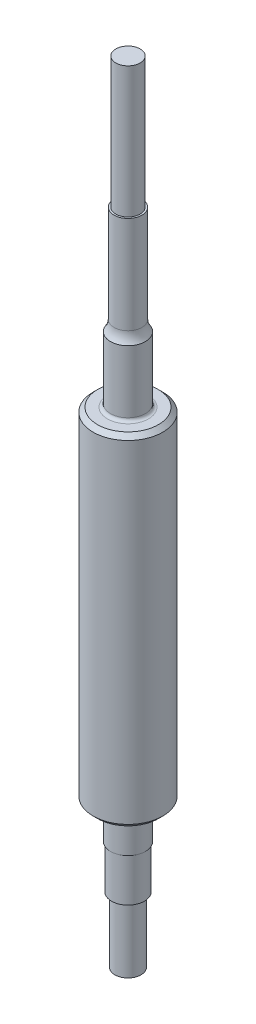
from build123d import *

# Parameters (mm, degrees)
SKETCH1_R           = 7.975
BOSS_EXTRUDE1_DEPTH = 78.2
SKETCH2_R           = 4
BOSS_EXTRUDE2_DEPTH = 15
BOSS_EXTRUDE3_START = 8
SKETCH3_R           = 4
BOSS_EXTRUDE3_DEPTH = 8
SKETCH4_R           = 3.195
BOSS_EXTRUDE4_DEPTH = 24.7
SKETCH5_R           = 2.79
BOSS_EXTRUDE5_DEPTH = 30
BOSS_EXTRUDE7_START = 8
SKETCH3_2_R         = 4
BOSS_EXTRUDE7_DEPTH = 8
SKETCH11_R          = 3.76
BOSS_EXTRUDE8_DEPTH = 10
SKETCH12_R          = 3
BOSS_EXTRUDE9_DEPTH = 15
CHAMFER6_SIZE       = 1
CHAMFER7_SIZE       = 1
FILLET1_R           = 0.7
FILLET3_R           = 0.7
FILLET4_R           = 4


with BuildPart() as part:
    # Sketch1 → Boss-Extrude1 (new body)
    with BuildSketch(Plane(origin=(0, 0, 0), x_dir=(1, 0, 0), z_dir=(0, 1, 0))):
        with Locations(Location((0, 0, 0), (0, 0, 270))):
            Circle(SKETCH1_R)
    extrude(amount=BOSS_EXTRUDE1_DEPTH)

    # Sketch2 → Boss-Extrude2 (add)
    with BuildSketch(Plane(origin=(0, 78.2, 0), x_dir=(1, 0, 0), z_dir=(0, 1, 0))):
        with Locations(Location((0, 0, 0), (0, 0, 270))):
            Circle(SKETCH2_R)
    extrude(amount=BOSS_EXTRUDE2_DEPTH)

    # Sketch3 → Boss-Extrude3 (add)
    with BuildSketch(Plane.XZ.offset(BOSS_EXTRUDE3_START)):
        with Locations(Location((0, 0, 0), (0, 0, 90))):
            Circle(SKETCH3_R)
    extrude(amount=-BOSS_EXTRUDE3_DEPTH)

    # Sketch4 → Boss-Extrude4 (add)
    with BuildSketch(Plane(origin=(0, 93.2, 0), x_dir=(1, 0, 0), z_dir=(0, 1, 0))):
        with Locations(Location((0, 0, 0), (0, 0, 270))):
            Circle(SKETCH4_R)
    extrude(amount=BOSS_EXTRUDE4_DEPTH)

    # Sketch5 → Boss-Extrude5 (add)
    with BuildSketch(Plane(origin=(0, 117.9, 0), x_dir=(1, 0, 0), z_dir=(0, 1, 0))):
        with Locations(Location((0, 0, 0), (0, 0, 270))):
            Circle(SKETCH5_R)
    extrude(amount=BOSS_EXTRUDE5_DEPTH)

    # Sketch3<2> → Boss-Extrude7 (add)
    with BuildSketch(Plane.XZ.offset(BOSS_EXTRUDE7_START)):
        with Locations(Location((0, 0, 0), (0, 0, 90))):
            Circle(SKETCH3_2_R)
    extrude(amount=-BOSS_EXTRUDE7_DEPTH)

    # Sketch11 → Boss-Extrude8 (add)
    with BuildSketch(Plane.XZ.offset(8)):
        with Locations(Location((0, 0, 0), (0, 0, 270))):
            Circle(SKETCH11_R)
    extrude(amount=BOSS_EXTRUDE8_DEPTH)

    # Sketch12 → Boss-Extrude9 (add)
    with BuildSketch(Plane.XZ.offset(18)):
        with Locations(Location((0, 0, 0), (0, 0, 270))):
            Circle(SKETCH12_R)
    extrude(amount=BOSS_EXTRUDE9_DEPTH)

    # Chamfer6
    chamfer6_edges = [part.edges().sort_by_distance(p)[0] for p in [
        (0, 78.2, -7.975),
    ]]
    chamfer(chamfer6_edges, length=CHAMFER6_SIZE)

    # Chamfer7
    chamfer7_edges = [part.edges().sort_by_distance(p)[0] for p in [
        (0, 0, -7.975),
    ]]
    chamfer(chamfer7_edges, length=CHAMFER7_SIZE)

    # Fillet1
    fillet1_edges = [part.edges().sort_by_distance(p)[0] for p in [
        (0, 78.2, -4),
    ]]
    fillet(fillet1_edges, radius=FILLET1_R)

    # Fillet3
    fillet3_edges = [part.edges().sort_by_distance(p)[0] for p in [
        (0, 0, -4),
    ]]
    fillet(fillet3_edges, radius=FILLET3_R)

    # Fillet4
    # the kernel refuses this fillet: 4 mm, written as the material it adds along each edge
    with BuildSketch(Plane(origin=(0, 93.2, 0), x_dir=(0, 0, 1), z_dir=(-1, 0, 0))) as fillet4_piece_1:
        with BuildLine():
            CenterArc((7.195, 2.406652239), FILLET4_R, 180, 36.989098612)
            Line((3.195, 2.406652239), (3.115, 2.406652239))
            Line((3.115, 2.406652239), (3.115, 0))
            Line((3.115, 0), (3.195, -0.08))
            ThreePointArc((3.195, -0.08), (3.5975, -0.08), (3.9361, -0.048133045))
            Line((3.9361, -0.048133045), (4, 0))
        make_face()
    revolve(axis=Axis((0, 93.2, 0), (0, 1, 0)))


solid = part.part
